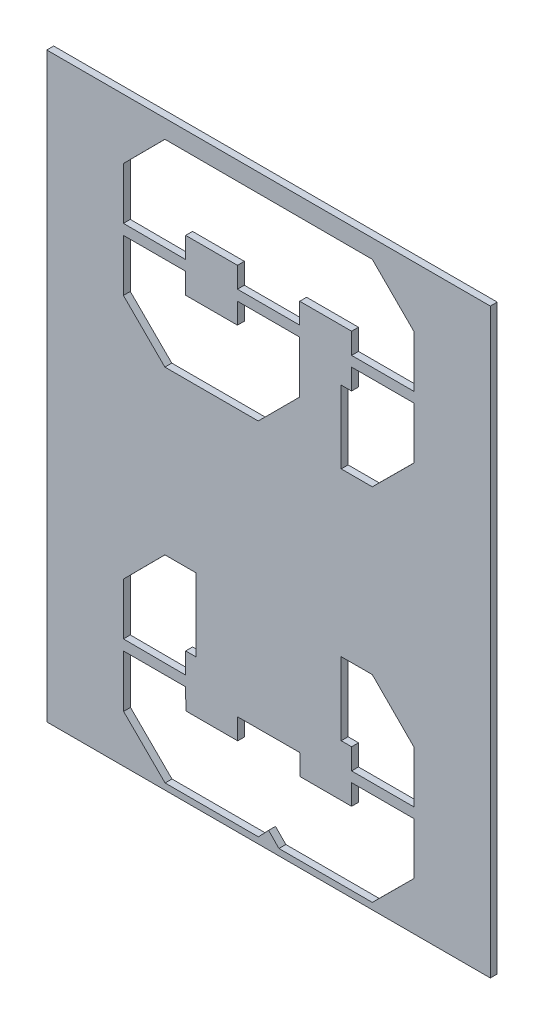
from build123d import *

# Parameters (mm, degrees)
SKETCH_1_W                 = 305.5
SKETCH_1_H                 = 1221.15
EXTRUDE_1_DEPTH            = 4.75
CUT_EXTRUDE_2_DEPTH        = 4.75
SPLIT_START                = 205.025
SPLIT_BODIES_2_OUTLINE_W   = 305.5
SPLIT_BODIES_2_OUTLINE_H   = 4.75
SPLIT_BODIES_2_DEPTH       = 405.55
SPLIT_START_2              = -610.575
SPLIT_BODIES_2_2_OUTLINE_W = 305.5
SPLIT_BODIES_2_2_OUTLINE_H = 4.75
SPLIT_BODIES_2_2_DEPTH     = 414.8


# Read off the part's stored shape, not the designer's step: 分割2
with BuildPart() as part:
    # 草圖1 → 填料-伸長1 (new body)
    with BuildSketch(Plane.XY):
        Rectangle(SKETCH_1_W, SKETCH_1_H)
    extrude(amount=EXTRUDE_1_DEPTH)

    # 草圖2 → 除料-伸長2 (cut)
    with BuildSketch(Plane.XY.offset(4.75)):
        Polygon((100.025, 354.412698413), (100.025, 304.423280423), (-83.25542328, 382.984126984), (-99.975, 390.137566138), (-99.975, 440.126984127), (83.30542328, 361.566137566), align=None)
        Polygon((57.189021164, 380.021164021), (57.189021164, 440.126984127), (100.025, 440.126984127), (100.025, 361.566137566), align=None)
        Polygon((50.035582011, 106.53968254), (57.189021164, 106.53968254), (57.189021164, 120.846560847), (100.025, 120.846560847), (100.025, 84.994708995), (71.453571429, 56.55026455), (50.035582011, 56.55026455), align=None)
        Polygon((-71.403571429, 56.55026455), (-99.975, 84.994708995), (-99.975, 120.846560847), (-57.096693122, 120.846560847), (-57.096693122, 106.53968254), (-21.414153439, 106.53968254), (-21.414153439, 120.846560847), (21.464153439, 120.846560847), (21.464153439, 85.121693122), (-7.107275132, 56.55026455), align=None)
        Polygon((-21.414153439, 142.264550265), (-57.096693122, 142.264550265), (-57.096693122, 127.830687831), (-99.975, 128), (-99.975, 163.682539683), (-71.403571429, 192.423280423), (71.453571429, 192.253968254), (100.025, 163.682539683), (100.025, 127.830687831), (57.189021164, 127.830687831), (57.189021164, 142.264550265), (21.464153439, 142.264550265), (21.464153439, 128), (-21.414153439, 128), align=None)
        Polygon((21.591137566, -141.164021164), (57.189021164, -141.164021164), (57.189021164, -127.026455026), (100.025, -127.026455026), (100.025, -162.878306878), (71.453571429, -191.322751323), (7.157275132, -191.322751323), (0.046164021, -184.042328042), (-6.980291005, -191.44973545), (-71.276587302, -191.44973545), (-99.848015873, -163.047619048), (-99.975, -127.026455026), (-57.096693122, -127.026455026), (-56.969708995, -141.333333333), (-21.24484127, -141.333333333), (-21.414153439, -127.026455026), (21.29484127, -126.899470899), (21.29484127, -127.153439153), (21.591137566, -127.153439153), align=None)
        Polygon((50.035582011, -55.44973545), (71.453571429, -55.44973545), (100.025, -84.19047619), (100.025, -120.042328042), (57.189021164, -120.042328042), (57.189021164, -105.608465608), (50.035582011, -105.608465608), align=None)
        Polygon((-49.985582011, -105.608465608), (-57.096693122, -105.608465608), (-57.096693122, -120.042328042), (-99.975, -119.873015873), (-99.975, -84.19047619), (-71.403571429, -55.44973545), (-49.985582011, -55.44973545), align=None)
        Polygon((50.035582011, -389.206349206), (57.189021164, -389.206349206), (57.189021164, -374.899470899), (100.025, -374.899470899), (100.025, -410.751322751), (71.453571429, -439.195767196), (50.035582011, -439.195767196), align=None)
        Polygon((-71.403571429, -439.195767196), (-99.975, -410.751322751), (-99.975, -374.899470899), (-57.096693122, -374.899470899), (-57.096693122, -389.206349206), (-21.414153439, -389.206349206), (-21.414153439, -374.899470899), (21.464153439, -374.899470899), (21.464153439, -410.624338624), (-7.107275132, -439.195767196), align=None)
        Polygon((-21.414153439, -353.481481481), (-57.096693122, -353.481481481), (-57.096693122, -367.915343915), (-99.975, -367.746031746), (-99.975, -332.063492063), (-71.403571429, -303.322751323), (71.453571429, -303.492063492), (100.025, -332.063492063), (100.025, -367.915343915), (57.189021164, -367.915343915), (57.189021164, -353.481481481), (21.464153439, -353.481481481), (21.464153439, -367.746031746), (-21.414153439, -367.746031746), align=None)
    extrude(amount=-CUT_EXTRUDE_2_DEPTH, mode=Mode.SUBTRACT)

    # Split Bodies 2 outline → Split Bodies 2 (cut)
    with BuildSketch(Plane(origin=(0, 0, 0), x_dir=(1, 0, 0), z_dir=(0, 1, 0)).offset(SPLIT_START)):
        with Locations((0, -2.375)):
            Rectangle(SPLIT_BODIES_2_OUTLINE_W, SPLIT_BODIES_2_OUTLINE_H)
    extrude(amount=SPLIT_BODIES_2_DEPTH, mode=Mode.SUBTRACT)

    # Split Bodies 2 2 outline → Split Bodies 2 2 (cut)
    with BuildSketch(Plane(origin=(0, 0, 0), x_dir=(1, 0, 0), z_dir=(0, 1, 0)).offset(SPLIT_START_2)):
        with Locations((0, -2.375)):
            Rectangle(SPLIT_BODIES_2_2_OUTLINE_W, SPLIT_BODIES_2_2_OUTLINE_H)
    extrude(amount=SPLIT_BODIES_2_2_DEPTH, mode=Mode.SUBTRACT)


solid = part.part
